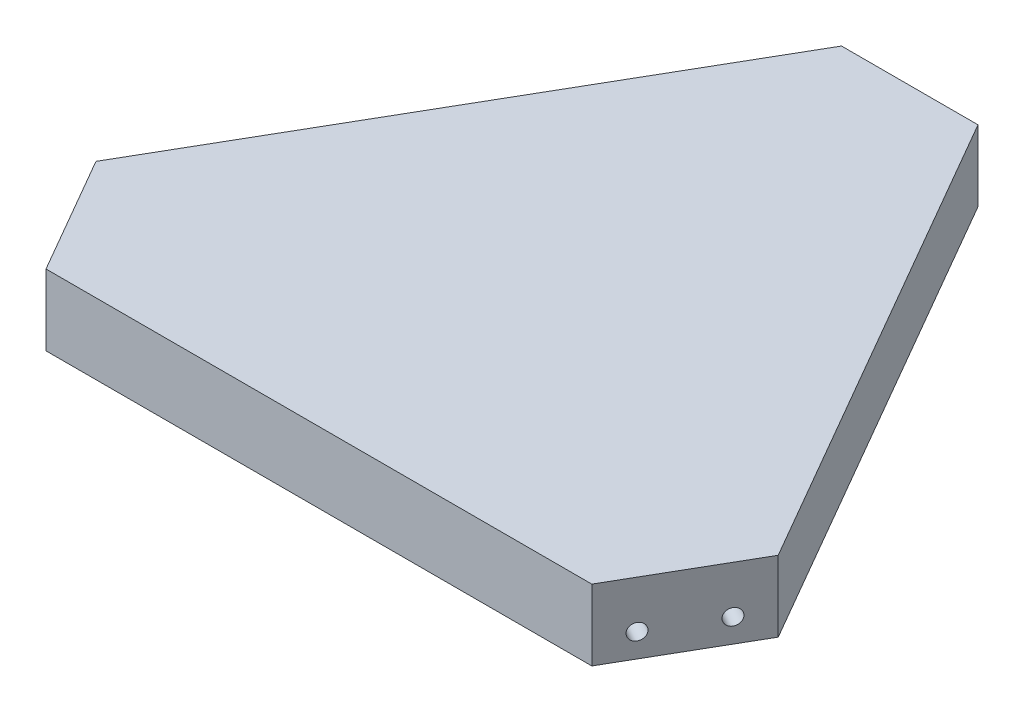
from build123d import *

# Parameters (mm, degrees)
BOSS_EXTRUDE1_DEPTH                = 15
M3_CLEARANCE_HOLE1_D               = 3.4
M3_CLEARANCE_HOLE1_DEPTH           = 23.978536948
M3_CLEARANCE_HOLE1_TIP             = 1.021463052
M3_CLEARANCE_HOLE1_ON_FACE_2_D     = 3.4
M3_CLEARANCE_HOLE1_ON_FACE_2_DEPTH = 23.978536948
M3_CLEARANCE_HOLE1_ON_FACE_2_TIP   = 1.021463052
M3_CLEARANCE_HOLE2_D               = 3.4
M3_CLEARANCE_HOLE2_DEPTH           = 23.978536948
M3_CLEARANCE_HOLE2_TIP             = 1.021463052
M3_CLEARANCE_HOLE3_D               = 3.4
M3_CLEARANCE_HOLE3_DEPTH           = 23.978536948
M3_CLEARANCE_HOLE3_TIP             = 1.021463052
M3_CLEARANCE_HOLE3_ON_FACE_2_D     = 3.4
M3_CLEARANCE_HOLE3_ON_FACE_2_DEPTH = 23.978536948
M3_CLEARANCE_HOLE3_ON_FACE_2_TIP   = 1.021463052


with BuildPart() as part:
    # Sketch1 → Boss-Extrude1 (new body)
    with BuildSketch(Plane(origin=(0, 0, 0), x_dir=(1, 0, 0), z_dir=(0, 1, 0))):
        Polygon((-14.43375673, 75), (-72.168783649, -25), (-57.735026919, -50), (57.735026919, -50), (72.168783649, -25), (14.43375673, 75), align=None)
    extrude(amount=BOSS_EXTRUDE1_DEPTH)

    # M3 Clearance Hole1
    with Locations(Plane(origin=(61.235026919, 5, 43.937822174), x_dir=(-0.5, 0, 0.866025403784), z_dir=(0.866025403784, 0, 0.5))):
        with Locations((0, 0)):
            Hole(M3_CLEARANCE_HOLE1_D / 2, depth=M3_CLEARANCE_HOLE1_DEPTH)
            with Locations((0, 0, -(M3_CLEARANCE_HOLE1_DEPTH + M3_CLEARANCE_HOLE1_TIP / 2))):  # 118° drill point
                Cone(0, M3_CLEARANCE_HOLE1_D / 2, M3_CLEARANCE_HOLE1_TIP, mode=Mode.SUBTRACT)

    # M3 Clearance Hole1 on face 2
    with Locations(Plane(origin=(68.668783649, 5, 31.062177826), x_dir=(-0.500000174844, 0, 0.866025302838), z_dir=(0.866025302838, 0, 0.500000174844))):
        with Locations((1e-09, 0)):
            Hole(M3_CLEARANCE_HOLE1_ON_FACE_2_D / 2, depth=M3_CLEARANCE_HOLE1_ON_FACE_2_DEPTH)
            with Locations((0, 0, -(M3_CLEARANCE_HOLE1_ON_FACE_2_DEPTH + M3_CLEARANCE_HOLE1_ON_FACE_2_TIP / 2))):  # 118° drill point
                Cone(0, M3_CLEARANCE_HOLE1_ON_FACE_2_D / 2, M3_CLEARANCE_HOLE1_ON_FACE_2_TIP, mode=Mode.SUBTRACT)

    # M3 Clearance Hole2
    with Locations(Plane(origin=(7.43375673, 5, -75), x_dir=(-1, 0, 0), z_dir=(0, 0, -1))):
        with Locations((0, 0), (14.86751346, 0)):
            Hole(M3_CLEARANCE_HOLE2_D / 2, depth=M3_CLEARANCE_HOLE2_DEPTH)
            with Locations((0, 0, -(M3_CLEARANCE_HOLE2_DEPTH + M3_CLEARANCE_HOLE2_TIP / 2))):  # 118° drill point
                Cone(0, M3_CLEARANCE_HOLE2_D / 2, M3_CLEARANCE_HOLE2_TIP, mode=Mode.SUBTRACT)

    # M3 Clearance Hole3
    with Locations(Plane(origin=(-68.668783649, 5, 31.062177826), x_dir=(-0.5, 0, -0.866025403784), z_dir=(-0.866025403784, 0, 0.5))):
        with Locations((-1e-09, 0)):
            Hole(M3_CLEARANCE_HOLE3_D / 2, depth=M3_CLEARANCE_HOLE3_DEPTH)
            with Locations((0, 0, -(M3_CLEARANCE_HOLE3_DEPTH + M3_CLEARANCE_HOLE3_TIP / 2))):  # 118° drill point
                Cone(0, M3_CLEARANCE_HOLE3_D / 2, M3_CLEARANCE_HOLE3_TIP, mode=Mode.SUBTRACT)

    # M3 Clearance Hole3 on face 2
    with Locations(Plane(origin=(-61.235026919, 5, 43.937822174), x_dir=(-0.500000174844, 0, -0.866025302838), z_dir=(-0.866025302838, 0, 0.500000174844))):
        with Locations((0, 0)):
            Hole(M3_CLEARANCE_HOLE3_ON_FACE_2_D / 2, depth=M3_CLEARANCE_HOLE3_ON_FACE_2_DEPTH)
            with Locations((0, 0, -(M3_CLEARANCE_HOLE3_ON_FACE_2_DEPTH + M3_CLEARANCE_HOLE3_ON_FACE_2_TIP / 2))):  # 118° drill point
                Cone(0, M3_CLEARANCE_HOLE3_ON_FACE_2_D / 2, M3_CLEARANCE_HOLE3_ON_FACE_2_TIP, mode=Mode.SUBTRACT)


solid = part.part
